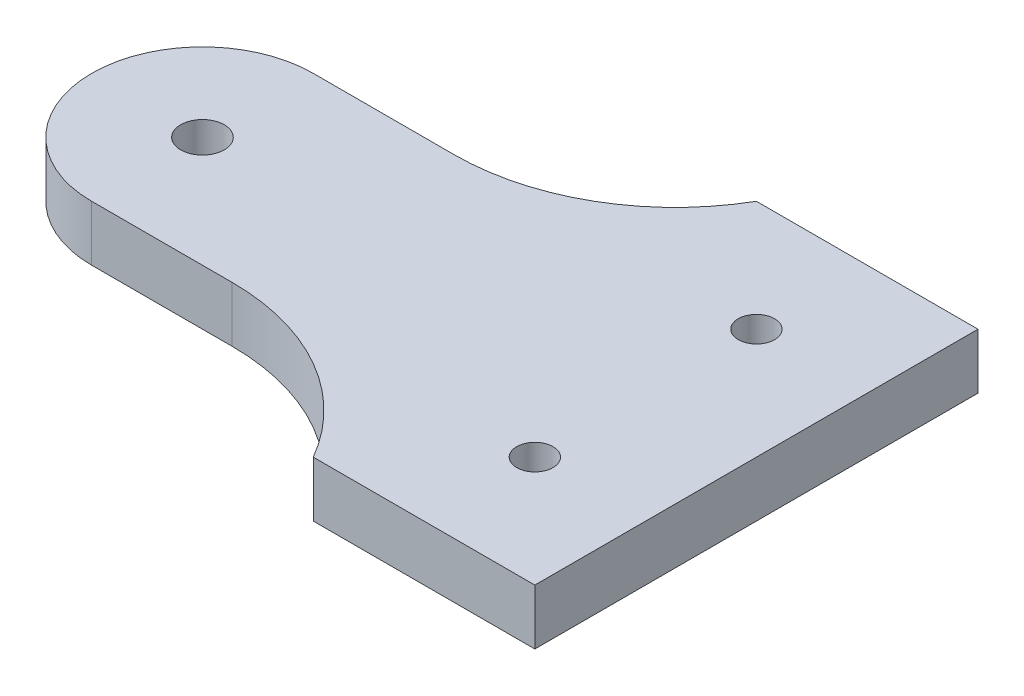
from build123d import *

# Parameters (mm, degrees)
BOSS_EXTRUDE1_DEPTH = 6.35
FILLET1_R           = 25.4
SKETCH2_R           = 2.5
CUT_EXTRUDE1_DEPTH  = 6.35
SKETCH3_R           = 2.0828
CUT_EXTRUDE2_DEPTH  = 6.35


with BuildPart() as part:
    # Sketch1 → Boss-Extrude1 (new body)
    with BuildSketch(Plane(origin=(0, 0, 0), x_dir=(1, 0, 0), z_dir=(0, 1, 0))):
        with BuildLine():
            Line((0, 12.7), (38.1, 12.7))
            Line((38.1, 12.7), (38.1, 25.4))
            Line((38.1, 25.4), (63.5, 25.4))
            Line((63.5, 25.4), (63.5, -25.4))
            Line((63.5, -25.4), (38.1, -25.4))
            Line((38.1, -25.4), (38.1, -12.7))
            Line((38.1, -12.7), (0, -12.7))
            ThreePointArc((0, -12.7), (-12.7, 0), (0, 12.7))
        make_face()
    extrude(amount=BOSS_EXTRUDE1_DEPTH)

    # Fillet1
    # the kernel refuses this fillet: 25.4 mm, written as the material it adds along each edge
    with BuildSketch(Plane(origin=(38.1, 0, 12.7), x_dir=(0, 0, 1), z_dir=(0, 1, 0))) as fillet1_piece_1:
        with BuildLine():
            CenterArc((25.4, -21.997045256), FILLET1_R, 120, 60)
            Line((0, -21.997045256), (-0.508, -21.997045256))
            Line((-0.508, -21.997045256), (-0.508, 0))
            Line((-0.508, 0), (0, 0.508))
            ThreePointArc((0, 0.508), (6.35, 0.508), (12.446, 0.439940905))
            Line((12.446, 0.439940905), (12.7, 0))
        make_face()
    extrude(amount=6.35)
    with BuildSketch(Plane(origin=(38.1, 0, -12.7), x_dir=(-1, 0, 0), z_dir=(0, 1, 0))) as fillet1_piece_2:
        with BuildLine():
            CenterArc((21.997045256, -25.4), FILLET1_R, 90, 60)
            Line((0, -12.7), (-0.439940905, -12.446))
            ThreePointArc((-0.439940905, -12.446), (-0.508, -6.35), (-0.508, 0))
            Line((-0.508, 0), (0, 0.508))
            Line((0, 0.508), (21.997045256, 0.508))
            Line((21.997045256, 0.508), (21.997045256, 0))
        make_face()
    extrude(amount=6.35)

    # Sketch2 → Cut-Extrude1 (cut)
    with BuildSketch(Plane(origin=(0, 6.35, 0), x_dir=(1, 0, 0), z_dir=(0, 1, 0))):
        with Locations(Location((0, 0, 0), (0, 0, 270))):
            Circle(SKETCH2_R)
    extrude(amount=-CUT_EXTRUDE1_DEPTH, mode=Mode.SUBTRACT)

    # Sketch3 → Cut-Extrude2 (cut)
    with BuildSketch(Plane(origin=(0, 6.35, 0), x_dir=(1, 0, 0), z_dir=(0, 1, 0))):
        with Locations(Location((50.8, 12.7, 0), (0, 0, 270))):
            Circle(SKETCH3_R)
        with Locations(Location((50.8, -12.7, 0), (0, 0, 270))):
            Circle(SKETCH3_R)
    extrude(amount=-CUT_EXTRUDE2_DEPTH, mode=Mode.SUBTRACT)


solid = part.part
